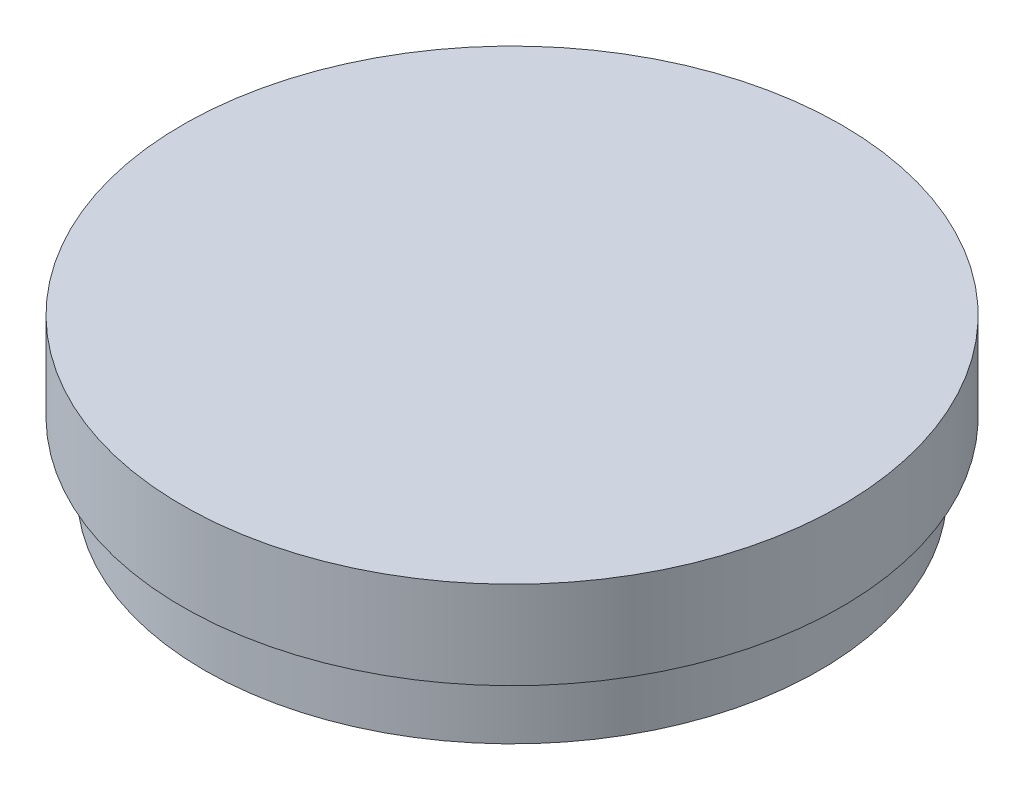
from build123d import *


with BuildPart() as part:
    # Sketch1 → Revolve1 (revolve)
    with BuildSketch(Plane.XY):
        Polygon((0, 0), (88.9, 0), (88.9, 19.05), (95.25, 19.05), (95.25, 44.45), (0, 44.45), align=None)
    revolve(axis=Axis((0, 0, 0), (0, 1, 0)))


solid = part.part
